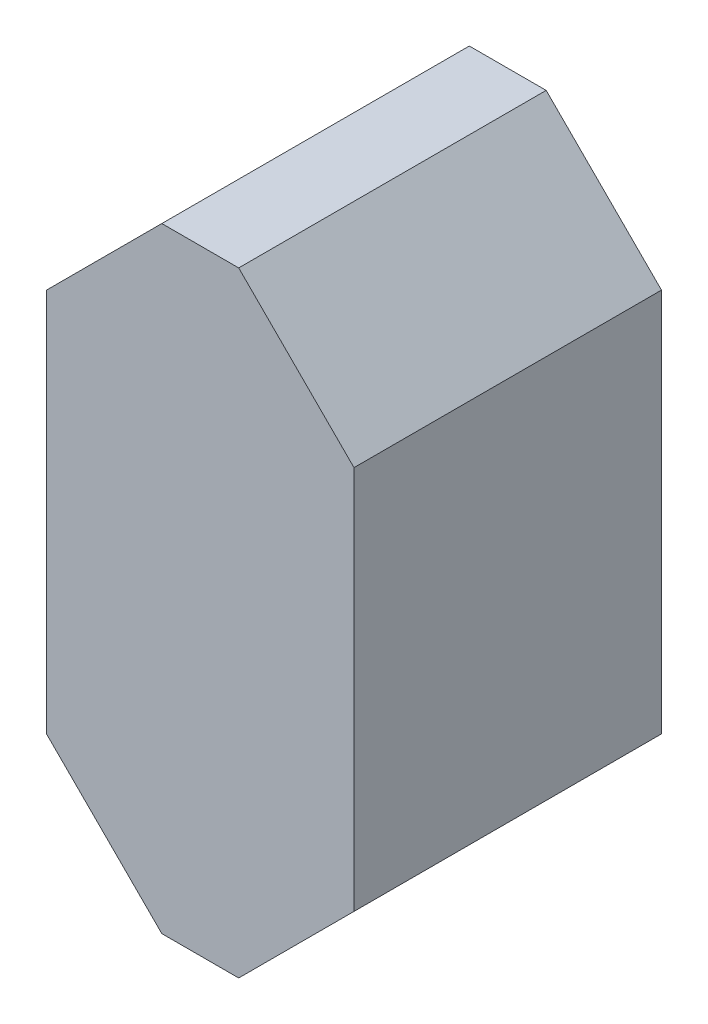
from build123d import *

# Parameters (mm, degrees)
SKETCH1_W           = 4
SKETCH1_H           = 8
BOSS_EXTRUDE1_DEPTH = 4
CHAMFER1_SIZE       = 1.5


with BuildPart() as part:
    # Sketch1 → Boss-Extrude1 (new body)
    with BuildSketch(Plane.XY):
        Rectangle(SKETCH1_W, SKETCH1_H)
    extrude(amount=BOSS_EXTRUDE1_DEPTH)

    # Chamfer1
    chamfer1_edges = [part.edges().sort_by_distance(p)[0] for p in [
        (-2, -4, 2),
        (2, -4, 2),
        (-2, 4, 2),
        (2, 4, 2),
    ]]
    chamfer(chamfer1_edges, length=CHAMFER1_SIZE)


solid = part.part
